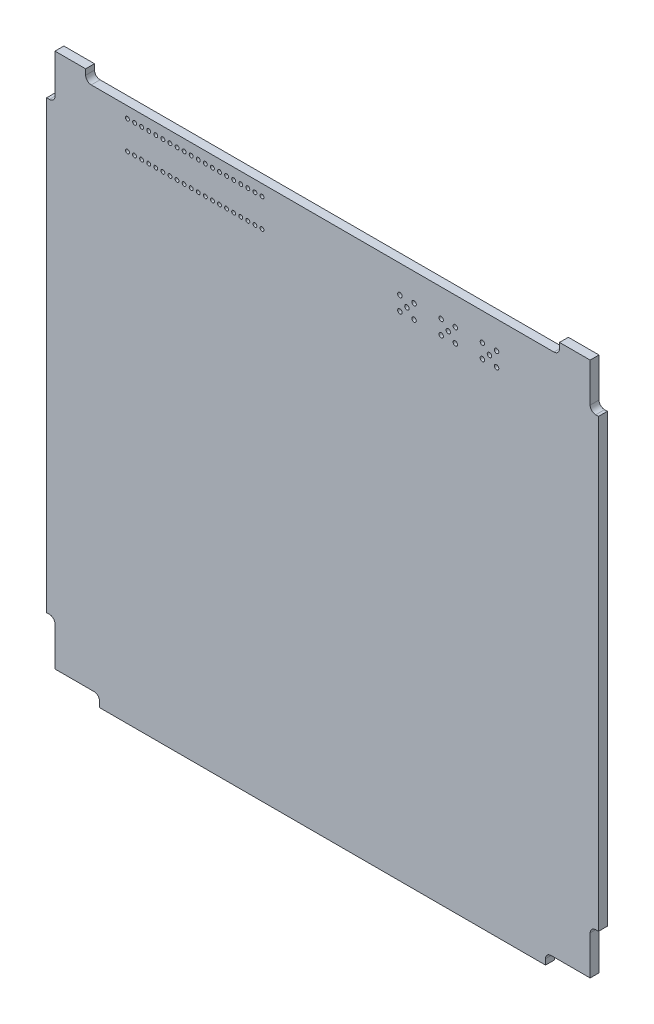
from build123d import *

# Parameters (mm, degrees)
BOSS_EXTRUDE1_DEPTH = 1.5875
SKETCH2_R           = 0.35
CUT_EXTRUDE1_DEPTH  = 71.728496069
SKETCH5_OUTSIDE_W   = 130.286
SKETCH5_OUTSIDE_H   = 130.286
SKETCH5_OUTSIDE_W_2 = 99
SKETCH5_OUTSIDE_H_2 = 100
CUT_EXTRUDE3_DEPTH  = 71.728496069
SKETCH8_W           = 85
SKETCH8_H           = 1.5875
CUT_EXTRUDE4_DEPTH  = 4
SKETCH6_R           = 0.4
CUT_EXTRUDE5_DEPTH  = 71.375920287
FILLET1_R           = 1


with BuildPart() as part:
    # Sketch1 → Boss-Extrude1 (new body)
    with BuildSketch(Plane.XY):
        Polygon((40, 50), (-40, 50), (-40, 48), (-48, 48), (-48, 40), (-50, 40), (-50, -37.864895224), (-50, -40), (-48, -40), (-48, -48), (-40, -48), (-40, -50), (-37.864895224, -50), (40, -50), (40, -48), (48, -48), (48, -40), (50, -40), (50, 40), (48, 40), (48, 48), (40, 48), align=None)
    extrude(amount=BOSS_EXTRUDE1_DEPTH)

    # Sketch2 → Cut-Extrude1 (cut, through all)
    with BuildSketch(Plane.XY.offset(1.5875)):
        with Locations((-35, 44)):
            Circle(SKETCH2_R)
        with Locations((-33.73, 44)):
            Circle(SKETCH2_R)
        with Locations((-32.46, 44)):
            Circle(SKETCH2_R)
        with Locations((-31.19, 44)):
            Circle(SKETCH2_R)
        with Locations((-29.92, 44)):
            Circle(SKETCH2_R)
        with Locations((-28.65, 44)):
            Circle(SKETCH2_R)
        with Locations((-27.38, 44)):
            Circle(SKETCH2_R)
        with Locations((-26.11, 44)):
            Circle(SKETCH2_R)
        with Locations((-24.84, 44)):
            Circle(SKETCH2_R)
        with Locations((-23.57, 44)):
            Circle(SKETCH2_R)
        with Locations((-22.3, 44)):
            Circle(SKETCH2_R)
        with Locations((-21.03, 44)):
            Circle(SKETCH2_R)
        with Locations((-19.76, 44)):
            Circle(SKETCH2_R)
        with Locations((-18.49, 44)):
            Circle(SKETCH2_R)
        with Locations((-17.22, 44)):
            Circle(SKETCH2_R)
        with Locations((-15.95, 44)):
            Circle(SKETCH2_R)
        with Locations((-14.68, 44)):
            Circle(SKETCH2_R)
        with Locations((-13.41, 44)):
            Circle(SKETCH2_R)
        with Locations((-12.14, 44)):
            Circle(SKETCH2_R)
        with Locations((-10.87, 44)):
            Circle(SKETCH2_R)
        with Locations((-33.73, 38.92)):
            Circle(SKETCH2_R)
        with Locations((-32.46, 38.92)):
            Circle(SKETCH2_R)
        with Locations((-31.19, 38.92)):
            Circle(SKETCH2_R)
        with Locations((-29.92, 38.92)):
            Circle(SKETCH2_R)
        with Locations((-28.65, 38.92)):
            Circle(SKETCH2_R)
        with Locations((-27.38, 38.92)):
            Circle(SKETCH2_R)
        with Locations((-26.11, 38.92)):
            Circle(SKETCH2_R)
        with Locations((-24.84, 38.92)):
            Circle(SKETCH2_R)
        with Locations((-23.57, 38.92)):
            Circle(SKETCH2_R)
        with Locations((-22.3, 38.92)):
            Circle(SKETCH2_R)
        with Locations((-21.03, 38.92)):
            Circle(SKETCH2_R)
        with Locations((-19.76, 38.92)):
            Circle(SKETCH2_R)
        with Locations((-18.49, 38.92)):
            Circle(SKETCH2_R)
        with Locations((-17.22, 38.92)):
            Circle(SKETCH2_R)
        with Locations((-15.95, 38.92)):
            Circle(SKETCH2_R)
        with Locations((-14.68, 38.92)):
            Circle(SKETCH2_R)
        with Locations((-13.41, 38.92)):
            Circle(SKETCH2_R)
        with Locations((-12.14, 38.92)):
            Circle(SKETCH2_R)
        with Locations((-10.87, 38.92)):
            Circle(SKETCH2_R)
        with Locations((-35, 38.92)):
            Circle(SKETCH2_R)
    extrude(amount=-CUT_EXTRUDE1_DEPTH, mode=Mode.SUBTRACT)

    # Sketch5 outside → Cut-Extrude3 (cut, through all)
    with BuildSketch(Plane(origin=(0, 0, 0), x_dir=(-1, 0, 0), z_dir=(0, 0, -1))):
        Rectangle(SKETCH5_OUTSIDE_W, SKETCH5_OUTSIDE_H)
        Rectangle(SKETCH5_OUTSIDE_W_2, SKETCH5_OUTSIDE_H_2, mode=Mode.SUBTRACT)
    extrude(amount=-CUT_EXTRUDE3_DEPTH, mode=Mode.SUBTRACT)

    # Sketch8 → Cut-Extrude4 (cut)
    with BuildSketch(Plane(origin=(0, 50, 0), x_dir=(1, 0, 0), z_dir=(0, 1, 0))):
        with Locations((0, -0.79375)):
            Rectangle(SKETCH8_W, SKETCH8_H)
    extrude(amount=-CUT_EXTRUDE4_DEPTH, mode=Mode.SUBTRACT)

    # Sketch6 → Cut-Extrude5 (cut, through all)
    with BuildSketch(Plane.XY.offset(1.5875)):
        with Locations((29.94, 39.7625)):
            Circle(SKETCH6_R)
        with Locations((28.67, 41.0325)):
            Circle(SKETCH6_R)
        with Locations((31.21, 41.0325)):
            Circle(SKETCH6_R)
        with Locations((31.21, 38.4925)):
            Circle(SKETCH6_R)
        with Locations((28.67, 38.4925)):
            Circle(SKETCH6_R)
        with Locations((22.54, 39.7625)):
            Circle(SKETCH6_R)
        with Locations((21.27, 41.0325)):
            Circle(SKETCH6_R)
        with Locations((23.81, 41.0325)):
            Circle(SKETCH6_R)
        with Locations((23.81, 38.4925)):
            Circle(SKETCH6_R)
        with Locations((21.27, 38.4925)):
            Circle(SKETCH6_R)
        with Locations((15.14, 39.7625)):
            Circle(SKETCH6_R)
        with Locations((13.87, 41.0325)):
            Circle(SKETCH6_R)
        with Locations((16.41, 41.0325)):
            Circle(SKETCH6_R)
        with Locations((16.41, 38.4925)):
            Circle(SKETCH6_R)
        with Locations((13.87, 38.4925)):
            Circle(SKETCH6_R)
    extrude(amount=-CUT_EXTRUDE5_DEPTH, mode=Mode.SUBTRACT)

    # Fillet1
    fillet1_edges = [part.edges().sort_by_distance(p)[0] for p in [
        (-48, -40, 0.79375),
        (-40, -48, 0.79375),
        (40, -48, 0.79375),
        (48, -40, 0.79375),
        (48, 40, 0.79375),
        (-48, 40, 0.79375),
        (42.5, 46, 0.79375),
        (-42.5, 46, 0.79375),
    ]]
    fillet(fillet1_edges, radius=FILLET1_R)


solid = part.part
